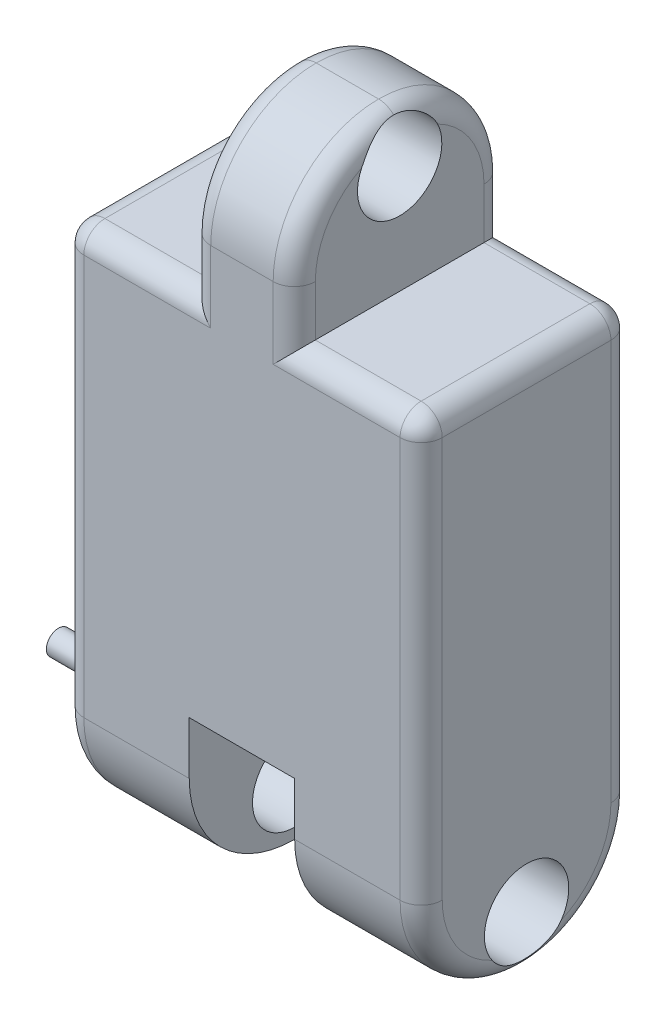
from build123d import *

# Parameters (mm, degrees)
BOSS_EXTRUDE1_DEPTH    = 100
SKETCH2_W              = 50
SKETCH2_H              = 50
CUT_EXTRUDE1_DEPTH     = 239.382046304
FILLET1_R              = 50
CUT_EXTRUDE2_DEPTH     = 25
SKETCH7_R              = 20
CUT_EXTRUDE3_DEPTH     = 281.180299093
FILLET2_R              = 50
CUT_EXTRUDE6_START     = -125
CUT_EXTRUDE6_OUTLINE_W = 50
CUT_EXTRUDE6_OUTLINE_H = 6.698729811
CUT_EXTRUDE6_DEPTH     = 50
CUT_EXTRUDE7_DEPTH     = 25
FILLET3_R              = 10
SKETCH11_W             = 50
SKETCH11_H             = 25
CUT_EXTRUDE8_DEPTH     = 99
BOSS_EXTRUDE7_DEPTH    = 0.1
FILLET4_R              = 10
FILLET5_R              = 10
SKETCH8_R              = 20
CUT_EXTRUDE9_DEPTH     = 249.348646185
SKETCH14_R             = 5.75
BOSS_EXTRUDE8_DEPTH    = 22


with BuildPart() as part:
    # Sketch1 → Boss-Extrude1 (new body)
    with BuildSketch(Plane.XY):
        Polygon((-24.8, 125), (-24.8, 199), (24.8, 199), (24.8, 125), (85, 125), (85, -125), (-85, -125), (-85, 125), align=None)
    extrude(amount=-BOSS_EXTRUDE1_DEPTH)

    # Sketch2 → Cut-Extrude1 (cut, through all)
    with BuildSketch(Plane.XY):
        with Locations((0, -125)):
            Rectangle(SKETCH2_W, SKETCH2_H)
    extrude(amount=-CUT_EXTRUDE1_DEPTH, mode=Mode.SUBTRACT)

    # Fillet1
    fillet1_edges = [part.edges().sort_by_distance(p)[0] for p in [
        (0, 199, -100),
        (0, 199, 0),
    ]]
    fillet(fillet1_edges, radius=FILLET1_R - 0.0001)  # a hair under: the kernel refuses the full size

    # Sketch6 → Cut-Extrude2 (cut, symmetric)
    with BuildSketch(Plane(origin=(0, 0, 0), x_dir=(0, 0, -1), z_dir=(1, 0, 0))):
        with BuildLine():
            Line((100, -100), (0, -100))
            ThreePointArc((0, -100), (50, -50), (100, -100))
        make_face()
    extrude(amount=CUT_EXTRUDE2_DEPTH, both=True, mode=Mode.SUBTRACT)

    # Sketch7 → Cut-Extrude3 (cut, through all)
    with BuildSketch(Plane.ZY.offset(85)):
        with Locations(Location((-50, -100, 0), (0, 0, 270))):
            Circle(SKETCH7_R)
    extrude(amount=-CUT_EXTRUDE3_DEPTH, mode=Mode.SUBTRACT)

    # Fillet2
    fillet2_edges = [part.edges().sort_by_distance(p)[0] for p in [
        (-55, -125, -100),
        (-55, -125, 0),
    ]]
    fillet(fillet2_edges, radius=FILLET2_R - 0.0001)  # a hair under: the kernel refuses the full size

    # Cut-Extrude6: read off the stored shape, not the designer's step
    # Cut-Extrude6 outline → Cut-Extrude6 (cut)
    with BuildSketch(Plane(origin=(0, 0, 0), x_dir=(1, 0, 0), z_dir=(0, 1, 0)).offset(CUT_EXTRUDE6_START)):
        with Locations((0, 96.650635095)):
            Rectangle(CUT_EXTRUDE6_OUTLINE_W, CUT_EXTRUDE6_OUTLINE_H)
        with Locations((0, 3.349364906)):
            Rectangle(CUT_EXTRUDE6_OUTLINE_W, CUT_EXTRUDE6_OUTLINE_H)
    extrude(amount=CUT_EXTRUDE6_DEPTH, mode=Mode.SUBTRACT)

    # Sketch10 → Cut-Extrude7 (cut, symmetric)
    with BuildSketch(Plane(origin=(0, 0, 0), x_dir=(0, 0, -1), z_dir=(1, 0, 0))):
        with BuildLine():
            Line((0, -75), (100, -75))
            ThreePointArc((100, -75), (50, -61.611517322), (0, -75))
        make_face()
    extrude(amount=CUT_EXTRUDE7_DEPTH, both=True, mode=Mode.SUBTRACT)

    # Fillet3
    # the kernel refuses this fillet: 10 mm, written as the material it takes off along each edge
    with BuildSketch(Plane(origin=(24.8, 149.0001, -100), x_dir=(0, 0, 1), z_dir=(0, -1, 0)), Plane(origin=(-24.8, 125, 0), x_dir=(1, 0, 0), z_dir=(0, 1, 0)), Plane(origin=(-24.8, 125, -100), x_dir=(0, 0, 1), z_dir=(0, 1, 0)), Plane(origin=(24.8, 149.0001, 0), x_dir=(-1, 0, 0), z_dir=(0, -1, 0))) as fillet3_piece_1:
        with BuildLine():
            CenterArc((FILLET3_R, FILLET3_R), FILLET3_R, 180, 90)
            Line((0, FILLET3_R), (0, 0))
            Line((0, 0), (FILLET3_R, 0))
        make_face()
    extrude(amount=24.0001, mode=Mode.SUBTRACT)
    with BuildSketch(Plane(origin=(24.8, 125, 0), x_dir=(0, -1, 0), z_dir=(1, 0, 0)), Plane(origin=(-110, 125, -100), x_dir=(0, 0, 1), z_dir=(1, 0, 0)), Plane(origin=(24.8, 125, -100), x_dir=(0, 0, 1), z_dir=(1, 0, 0)), Plane(origin=(-110, 125, 0), x_dir=(0, -1, 0), z_dir=(1, 0, 0))) as fillet3_piece_2:
        with BuildLine():
            CenterArc((FILLET3_R, FILLET3_R), FILLET3_R, 180, 90)
            Line((0, FILLET3_R), (0, 0))
            Line((0, 0), (FILLET3_R, 0))
        make_face()
    extrude(amount=85.2, mode=Mode.SUBTRACT)
    with BuildSketch(Plane(origin=(-85, -75.0001, -100), x_dir=(0, 0, 1), z_dir=(0, 1, 0)), Plane(origin=(85, 150, 0), x_dir=(-1, 0, 0), z_dir=(0, -1, 0)), Plane(origin=(85, 150, -100), x_dir=(0, 0, 1), z_dir=(0, -1, 0)), Plane(origin=(-85, -75.0001, 0), x_dir=(1, 0, 0), z_dir=(0, 1, 0))) as fillet3_piece_3:
        with BuildLine():
            CenterArc((FILLET3_R, FILLET3_R), FILLET3_R, 180, 90)
            Line((0, FILLET3_R), (0, 0))
            Line((0, 0), (FILLET3_R, 0))
        make_face()
    extrude(amount=225.0001, mode=Mode.SUBTRACT)
    with BuildSketch(Plane(origin=(-24.8, 149.0001, -49.9999), x_dir=(0, 1, 0), z_dir=(0, 0, -1))) as fillet3_piece_4:
        with BuildLine():
            CenterArc((49.9999 - FILLET3_R, FILLET3_R), FILLET3_R, 270, 90)
            Line((49.9999 - FILLET3_R, 0), (49.9999, 0))
            Line((49.9999, 0), (49.9999, FILLET3_R))
        make_face()
    revolve(axis=Axis((-24.8, 149.0001, -49.9999), (1, 0, 0)), revolution_arc=90, mode=Mode.SUBTRACT)
    with BuildSketch(Plane(origin=(-24.8, 149.0001, -50.0001), x_dir=(0, 1, 0), z_dir=(0, 0, 1))) as fillet3_piece_5:
        with BuildLine():
            CenterArc((49.9999 - FILLET3_R, -FILLET3_R), FILLET3_R, 0, 90)
            Line((49.9999, -FILLET3_R), (49.9999, 0))
            Line((49.9999, 0), (49.9999 - FILLET3_R, 0))
        make_face()
    revolve(axis=Axis((-24.8, 149.0001, -50.0001), (-1, 0, 0)), revolution_arc=90, mode=Mode.SUBTRACT)
    with BuildSketch(Plane(origin=(24.8, 149.0001, -49.9999), x_dir=(0, 1, 0), z_dir=(0, 0, -1))) as fillet3_piece_6:
        with BuildLine():
            CenterArc((49.9999 - FILLET3_R, -FILLET3_R), FILLET3_R, 0, 90)
            Line((49.9999, -FILLET3_R), (49.9999, 0))
            Line((49.9999, 0), (49.9999 - FILLET3_R, 0))
        make_face()
    revolve(axis=Axis((24.8, 149.0001, -49.9999), (1, 0, 0)), revolution_arc=90, mode=Mode.SUBTRACT)
    with BuildSketch(Plane(origin=(24.8, 149.0001, -50.0001), x_dir=(0, 1, 0), z_dir=(0, 0, 1))) as fillet3_piece_7:
        with BuildLine():
            CenterArc((49.9999 - FILLET3_R, FILLET3_R), FILLET3_R, 270, 90)
            Line((49.9999, FILLET3_R), (49.9999, 0))
            Line((49.9999, 0), (49.9999 - FILLET3_R, 0))
        make_face()
    revolve(axis=Axis((24.8, 149.0001, -50.0001), (-1, 0, 0)), revolution_arc=90, mode=Mode.SUBTRACT)
    with BuildSketch(Plane(origin=(85, -75.0001, -49.9999), x_dir=(0, 0, 1), z_dir=(0, 1, 0))) as fillet3_piece_8:
        with BuildLine():
            CenterArc((49.9999 - FILLET3_R, -FILLET3_R), FILLET3_R, 0, 90)
            Line((49.9999, -FILLET3_R), (49.9999, 0))
            Line((49.9999, 0), (49.9999 - FILLET3_R, 0))
        make_face()
    revolve(axis=Axis((85, -75.0001, -49.9999), (1, 0, 0)), revolution_arc=90, mode=Mode.SUBTRACT)
    with BuildSketch(Plane(origin=(85, -75.0001, -50.0001), x_dir=(0, 0, -1), z_dir=(0, 1, 0))) as fillet3_piece_9:
        with BuildLine():
            CenterArc((49.9999 - FILLET3_R, FILLET3_R), FILLET3_R, 270, 90)
            Line((49.9999, FILLET3_R), (49.9999, 0))
            Line((49.9999, 0), (49.9999 - FILLET3_R, 0))
        make_face()
    revolve(axis=Axis((85, -75.0001, -50.0001), (-1, 0, 0)), revolution_arc=90, mode=Mode.SUBTRACT)
    with BuildSketch(Plane(origin=(-85, -75.0001, -49.9999), x_dir=(0, 0, 1), z_dir=(0, 1, 0))) as fillet3_piece_10:
        with BuildLine():
            CenterArc((49.9999 - FILLET3_R, FILLET3_R), FILLET3_R, 270, 90)
            Line((49.9999, FILLET3_R), (49.9999, 0))
            Line((49.9999, 0), (49.9999 - FILLET3_R, 0))
        make_face()
    revolve(axis=Axis((-85, -75.0001, -49.9999), (1, 0, 0)), revolution_arc=90, mode=Mode.SUBTRACT)
    with BuildSketch(Plane(origin=(-85, -75.0001, -50.0001), x_dir=(0, 0, -1), z_dir=(0, 1, 0))) as fillet3_piece_11:
        with BuildLine():
            CenterArc((49.9999 - FILLET3_R, -FILLET3_R), FILLET3_R, 0, 90)
            Line((49.9999, -FILLET3_R), (49.9999, 0))
            Line((49.9999, 0), (49.9999 - FILLET3_R, 0))
        make_face()
    revolve(axis=Axis((-85, -75.0001, -50.0001), (-1, 0, 0)), revolution_arc=90, mode=Mode.SUBTRACT)
    with BuildSketch(Plane(origin=(-85, -125, -49.9999), x_dir=(0, 1, 0), z_dir=(0, 0, -1)), Plane(origin=(24.8, 199, -49.9999), x_dir=(0, -1, 0), z_dir=(0, 0, -1))) as fillet3_piece_12:
        with BuildLine():
            CenterArc((FILLET3_R, FILLET3_R), FILLET3_R, 180, 90)
            Line((0, FILLET3_R), (0, 0))
            Line((0, 0), (FILLET3_R, 0))
        make_face()
    extrude(amount=0.0002, mode=Mode.SUBTRACT)
    with BuildSketch(Plane(origin=(85, -125, -49.9999), x_dir=(0, 1, 0), z_dir=(0, 0, -1)), Plane(origin=(-24.8, 199, -49.9999), x_dir=(0, -1, 0), z_dir=(0, 0, -1))) as fillet3_piece_13:
        with BuildLine():
            CenterArc((FILLET3_R, -FILLET3_R), FILLET3_R, 90, 90)
            Line((0, -FILLET3_R), (0, 0))
            Line((0, 0), (FILLET3_R, 0))
        make_face()
    extrude(amount=0.0002, mode=Mode.SUBTRACT)
    with BuildSketch(Plane(origin=(-0.2, 125, -100), x_dir=(0, 0, 1), z_dir=(1, 0, 0))) as fillet3_piece_14a_section:
        with BuildLine():
            CenterArc((FILLET3_R, FILLET3_R), FILLET3_R, 180, 90)
            Line((0, FILLET3_R), (0, 0))
            Line((0, 0), (FILLET3_R, 0))
        make_face()
    fillet3_piece_14a = extrude(amount=110.2, mode=Mode.PRIVATE)
    fillet3_piece_14a = split(fillet3_piece_14a, bisect_by=Plane(origin=(24.8, 125, -100), z_dir=(-1, 0, 0)), keep=Keep.TOP, mode=Mode.PRIVATE)
    with BuildSketch(Plane(origin=(24.8, 149.0001, -100), x_dir=(0, 0, 1), z_dir=(0, -1, 0))) as fillet3_piece_14b_section:
        with BuildLine():
            CenterArc((FILLET3_R, FILLET3_R), FILLET3_R, 180, 90)
            Line((0, FILLET3_R), (0, 0))
            Line((0, 0), (FILLET3_R, 0))
        make_face()
    fillet3_piece_14b = extrude(amount=49.0001, mode=Mode.PRIVATE)
    fillet3_piece_14b = split(fillet3_piece_14b, bisect_by=Plane(origin=(24.8, 125, -100), z_dir=(0, -1, 0)), keep=Keep.TOP, mode=Mode.PRIVATE)
    fillet3_piece_14 = fillet3_piece_14a & fillet3_piece_14b
    add(fillet3_piece_14, mode=Mode.SUBTRACT)
    with BuildSketch(Plane(origin=(-0.2, 125, 0), x_dir=(0, -1, 0), z_dir=(1, 0, 0))) as fillet3_piece_15a_section:
        with BuildLine():
            CenterArc((FILLET3_R, FILLET3_R), FILLET3_R, 180, 90)
            Line((0, FILLET3_R), (0, 0))
            Line((0, 0), (FILLET3_R, 0))
        make_face()
    fillet3_piece_15a = extrude(amount=110.2, mode=Mode.PRIVATE)
    fillet3_piece_15a = split(fillet3_piece_15a, bisect_by=Plane(origin=(24.8, 125, 0), z_dir=(-1, 0, 0)), keep=Keep.TOP, mode=Mode.PRIVATE)
    with BuildSketch(Plane(origin=(24.8, 149.0001, 0), x_dir=(-1, 0, 0), z_dir=(0, -1, 0))) as fillet3_piece_15b_section:
        with BuildLine():
            CenterArc((FILLET3_R, FILLET3_R), FILLET3_R, 180, 90)
            Line((0, FILLET3_R), (0, 0))
            Line((0, 0), (FILLET3_R, 0))
        make_face()
    fillet3_piece_15b = extrude(amount=49.0001, mode=Mode.PRIVATE)
    fillet3_piece_15b = split(fillet3_piece_15b, bisect_by=Plane(origin=(24.8, 125, 0), z_dir=(0, -1, 0)), keep=Keep.TOP, mode=Mode.PRIVATE)
    fillet3_piece_15 = fillet3_piece_15a & fillet3_piece_15b
    add(fillet3_piece_15, mode=Mode.SUBTRACT)
    with BuildSketch(Plane(origin=(-24.8, 100, -100), x_dir=(0, 0, 1), z_dir=(0, 1, 0))) as fillet3_piece_16a_section:
        with BuildLine():
            CenterArc((FILLET3_R, FILLET3_R), FILLET3_R, 180, 90)
            Line((0, FILLET3_R), (0, 0))
            Line((0, 0), (FILLET3_R, 0))
        make_face()
    fillet3_piece_16a = extrude(amount=49.0001, mode=Mode.PRIVATE)
    fillet3_piece_16a = split(fillet3_piece_16a, bisect_by=Plane(origin=(-24.8, 125, -100), z_dir=(0, -1, 0)), keep=Keep.TOP, mode=Mode.PRIVATE)
    with BuildSketch(Plane(origin=(-110, 125, -100), x_dir=(0, 0, 1), z_dir=(1, 0, 0))) as fillet3_piece_16b_section:
        with BuildLine():
            CenterArc((FILLET3_R, FILLET3_R), FILLET3_R, 180, 90)
            Line((0, FILLET3_R), (0, 0))
            Line((0, 0), (FILLET3_R, 0))
        make_face()
    fillet3_piece_16b = extrude(amount=110.2, mode=Mode.PRIVATE)
    fillet3_piece_16b = split(fillet3_piece_16b, bisect_by=Plane(origin=(-24.8, 125, -100), z_dir=(1, 0, 0)), keep=Keep.TOP, mode=Mode.PRIVATE)
    fillet3_piece_16 = fillet3_piece_16a & fillet3_piece_16b
    add(fillet3_piece_16, mode=Mode.SUBTRACT)
    with BuildSketch(Plane(origin=(-24.8, 100, 0), x_dir=(1, 0, 0), z_dir=(0, 1, 0))) as fillet3_piece_17a_section:
        with BuildLine():
            CenterArc((FILLET3_R, FILLET3_R), FILLET3_R, 180, 90)
            Line((0, FILLET3_R), (0, 0))
            Line((0, 0), (FILLET3_R, 0))
        make_face()
    fillet3_piece_17a = extrude(amount=49.0001, mode=Mode.PRIVATE)
    fillet3_piece_17a = split(fillet3_piece_17a, bisect_by=Plane(origin=(-24.8, 125, 0), z_dir=(0, -1, 0)), keep=Keep.TOP, mode=Mode.PRIVATE)
    with BuildSketch(Plane(origin=(-110, 125, 0), x_dir=(0, -1, 0), z_dir=(1, 0, 0))) as fillet3_piece_17b_section:
        with BuildLine():
            CenterArc((FILLET3_R, FILLET3_R), FILLET3_R, 180, 90)
            Line((0, FILLET3_R), (0, 0))
            Line((0, 0), (FILLET3_R, 0))
        make_face()
    fillet3_piece_17b = extrude(amount=110.2, mode=Mode.PRIVATE)
    fillet3_piece_17b = split(fillet3_piece_17b, bisect_by=Plane(origin=(-24.8, 125, 0), z_dir=(1, 0, 0)), keep=Keep.TOP, mode=Mode.PRIVATE)
    fillet3_piece_17 = fillet3_piece_17a & fillet3_piece_17b
    add(fillet3_piece_17, mode=Mode.SUBTRACT)

    # Sketch11 → Cut-Extrude8 (cut)
    with BuildSketch(Plane.XY):
        with Locations((0, -62.5)):
            Rectangle(SKETCH11_W, SKETCH11_H)
    extrude(amount=-CUT_EXTRUDE8_DEPTH, mode=Mode.SUBTRACT)

    # Fillet5
    # the kernel refuses this fillet: 10 mm, written as the material it takes off along each edge
    with BuildSketch(Plane(origin=(75, 115, -10), x_dir=(0, 1, 0), z_dir=(1, 0, 0))) as fillet5_piece_1_section:
        Polygon((0, 0), (FILLET5_R, 0), (FILLET5_R, FILLET5_R), (0, FILLET5_R), align=None)
    fillet5_piece_1 = extrude(amount=FILLET5_R, mode=Mode.PRIVATE)
    fillet5_piece_1 = fillet5_piece_1 - Plane(origin=(75, 115, -10), x_dir=(0, -0.7071067811865475, -0.7071067811865475), z_dir=(1, 0, 0)) * Sphere(FILLET5_R, mode=Mode.PRIVATE)
    add(fillet5_piece_1, mode=Mode.SUBTRACT)
    with BuildSketch(Plane(origin=(75, 115, -90), x_dir=(0, 1, 0), z_dir=(1, 0, 0))) as fillet5_piece_2_section:
        Polygon((0, 0), (FILLET5_R, 0), (FILLET5_R, -FILLET5_R), (0, -FILLET5_R), align=None)
    fillet5_piece_2 = extrude(amount=FILLET5_R, mode=Mode.PRIVATE)
    fillet5_piece_2 = fillet5_piece_2 - Plane(origin=(75, 115, -90), x_dir=(0, -0.7071067811865475, 0.7071067811865475), z_dir=(1, 0, 0)) * Sphere(FILLET5_R, mode=Mode.PRIVATE)
    add(fillet5_piece_2, mode=Mode.SUBTRACT)
    with BuildSketch(Plane(origin=(-75, 115, -90), x_dir=(0, 1, 0), z_dir=(-1, 0, 0))) as fillet5_piece_3_section:
        Polygon((0, 0), (FILLET5_R, 0), (FILLET5_R, FILLET5_R), (0, FILLET5_R), align=None)
    fillet5_piece_3 = extrude(amount=FILLET5_R, mode=Mode.PRIVATE)
    fillet5_piece_3 = fillet5_piece_3 - Plane(origin=(-75, 115, -90), x_dir=(0, -0.7071067811865475, 0.7071067811865475), z_dir=(-1, 0, 0)) * Sphere(FILLET5_R, mode=Mode.PRIVATE)
    add(fillet5_piece_3, mode=Mode.SUBTRACT)
    with BuildSketch(Plane(origin=(-75, 115, -10), x_dir=(0, 1, 0), z_dir=(-1, 0, 0))) as fillet5_piece_4_section:
        Polygon((0, 0), (FILLET5_R, 0), (FILLET5_R, -FILLET5_R), (0, -FILLET5_R), align=None)
    fillet5_piece_4 = extrude(amount=FILLET5_R, mode=Mode.PRIVATE)
    fillet5_piece_4 = fillet5_piece_4 - Plane(origin=(-75, 115, -10), x_dir=(0, -0.7071067811865475, -0.7071067811865475), z_dir=(-1, 0, 0)) * Sphere(FILLET5_R, mode=Mode.PRIVATE)
    add(fillet5_piece_4, mode=Mode.SUBTRACT)
    with BuildSketch(Plane(origin=(85, 125, -10), x_dir=(0, -1, 0), z_dir=(0, 0, -1))) as fillet5_piece_5:
        with BuildLine():
            CenterArc((FILLET5_R, FILLET5_R), FILLET5_R, 180, 90)
            Line((0, FILLET5_R), (0, 0))
            Line((0, 0), (FILLET5_R, 0))
        make_face()
    extrude(amount=80, mode=Mode.SUBTRACT)
    with BuildSketch(Plane(origin=(-85, 125, -10), x_dir=(0, -1, 0), z_dir=(0, 0, -1))) as fillet5_piece_6:
        with BuildLine():
            CenterArc((FILLET5_R, -FILLET5_R), FILLET5_R, 90, 90)
            Line((0, -FILLET5_R), (0, 0))
            Line((0, 0), (FILLET5_R, 0))
        make_face()
    extrude(amount=80, mode=Mode.SUBTRACT)

    # Sketch8 → Cut-Extrude9 (cut, through all)
    with BuildSketch(Plane(origin=(24.8, 0, 0), x_dir=(0, 0, -1), z_dir=(1, 0, 0))):
        with Locations(Location((50, 176, 0), (0, 0, 25.856016698))):
            Circle(SKETCH8_R)
    extrude(amount=-CUT_EXTRUDE9_DEPTH, mode=Mode.SUBTRACT)

    # Sketch14 → Boss-Extrude8 (add)
    with BuildSketch(Plane.ZY.offset(85)):
        with Locations(Location((-20, -70, 0), (0, 0, 270))):
            Circle(SKETCH14_R)
    extrude(amount=BOSS_EXTRUDE8_DEPTH)


with BuildPart() as body_2:
    # Sketch13 → Boss-Extrude7 (new body)
    with BuildSketch(Plane(origin=(0, 0, -100), x_dir=(-1, 0, 0), z_dir=(0, 0, -1))):
        Polygon((-25, -75), (-25, -105), (25.018802851, -105), (25, -75), align=None)
    extrude(amount=BOSS_EXTRUDE7_DEPTH)

    # Fillet4
    # the kernel refuses this fillet: 10 mm, written as the material it takes off along each edge
    with BuildSketch(Plane(origin=(-25.021013242, -108.526683302, -100.1), x_dir=(0, 0, 1), z_dir=(0.0006267615930631998, 0.9999998035849335, 0))) as fillet4_piece_1:
        with BuildLine():
            CenterArc((10, 1.410673598), FILLET4_R, 180, 8.109614456)
            Line((0, 1.410673598), (0, 0))
            Line((0, 0), (0.1, 0))
        make_face()
    extrude(amount=37.053373882, mode=Mode.SUBTRACT)
    with BuildSketch(Plane(origin=(25, -71.473316005, -100.1), x_dir=(0, 0, 1), z_dir=(0, -1, 0))) as fillet4_piece_2:
        with BuildLine():
            CenterArc((10, 1.410673598), FILLET4_R, 180, 8.109614456)
            Line((0, 1.410673598), (0, 0))
            Line((0, 0), (0.1, 0))
        make_face()
    extrude(amount=37.05336799, mode=Mode.SUBTRACT)
    with BuildSketch(Plane(origin=(28.526683995, -105, -100.1), x_dir=(0, 0, 1), z_dir=(-1, 0, 0))) as fillet4_piece_3:
        with BuildLine():
            CenterArc((10, 1.410673598), FILLET4_R, 180, 8.109614456)
            Line((0, 1.410673598), (0, 0))
            Line((0, 0), (0.1, 0))
        make_face()
    extrude(amount=57.072170841, mode=Mode.SUBTRACT)


solid = Compound([part.part, body_2.part])
